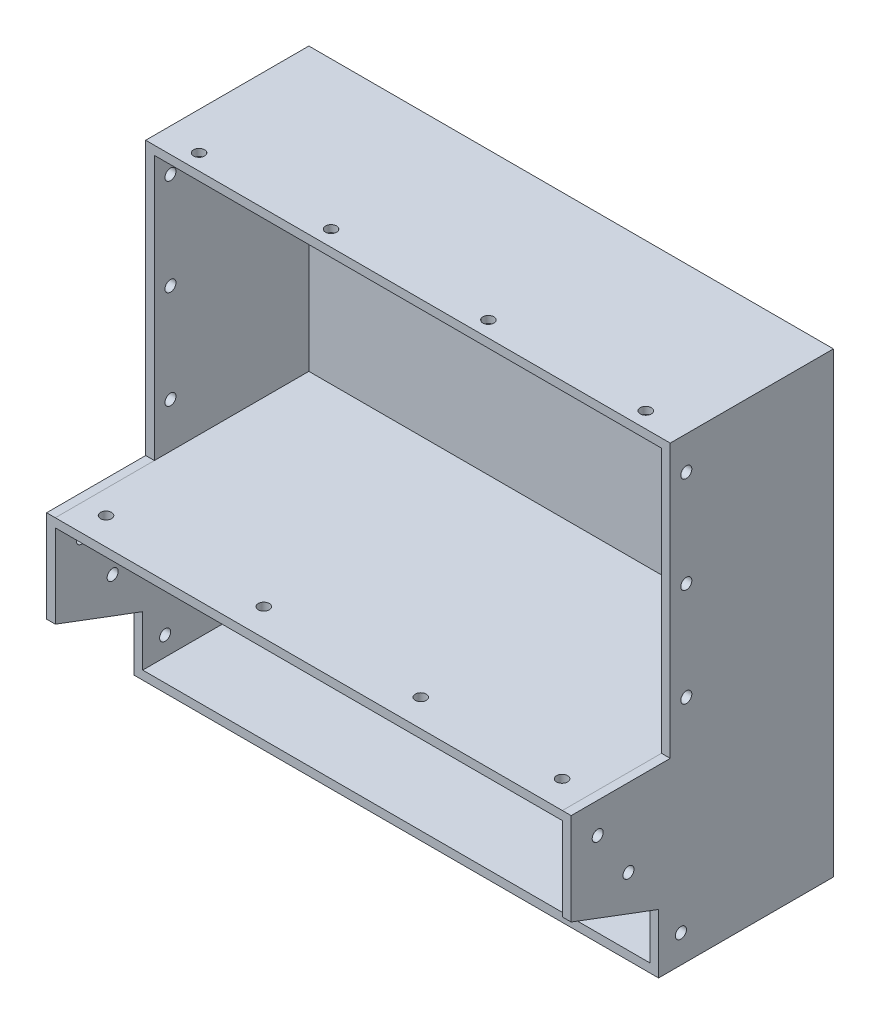
from build123d import *

# Parameters (mm, degrees)
SKETCH1_W           = 190.5
SKETCH1_H           = 166.116
BOSS_EXTRUDE1_DEPTH = 95.25
CUT_EXTRUDE1_DEPTH  = 92.075
CUT_EXTRUDE5_DEPTH  = 35.98418
SKETCH17_W          = 190.5
SKETCH17_H          = 33.474363619
CUT_EXTRUDE6_DEPTH  = 31.75
BOSS_EXTRUDE8_DEPTH = 190.5
SKETCH19_W          = 184.15
SKETCH19_H          = 30.313503047
CUT_EXTRUDE7_DEPTH  = 92.075
SKETCH20_W          = 184.15
SKETCH20_H          = 33.914711244
CUT_EXTRUDE8_DEPTH  = 13.175
CUT_EXTRUDE9_DEPTH  = 60.325
SKETCH23_R          = 2.00000108
CUT_EXTRUDE10_DEPTH = 2.54
SKETCH24_R          = 2
SKETCH24_R_2        = 2.00000108
CUT_EXTRUDE11_DEPTH = 2.54
SKETCH25_R          = 2.00000108
CUT_EXTRUDE12_DEPTH = 229.607619873
SKETCH27_R          = 2.00000108
CUT_EXTRUDE13_DEPTH = 3.175
SKETCH28_R          = 2.00000108
CUT_EXTRUDE15_DEPTH = 229.607619873


with BuildPart() as part:
    # Sketch1 → Boss-Extrude1 (new body)
    with BuildSketch(Plane.XY):
        Rectangle(SKETCH1_W, SKETCH1_H)
    extrude(amount=BOSS_EXTRUDE1_DEPTH)

    # Sketch3 → Cut-Extrude1 (cut)
    with BuildSketch(Plane.XY.offset(95.25)):
        Polygon((83.88326961, 79.883), (-81.085829842, 79.883), (-92.075, 79.883), (-92.075, 32.891702926), (-92.075, -16.095133334), (92.075, -16.095133334), (92.075, 48.662739539), (92.075, 79.883), align=None)
    extrude(amount=-CUT_EXTRUDE1_DEPTH, mode=Mode.SUBTRACT)

    # Sketch15 → Cut-Extrude5 (cut)
    with BuildSketch(Plane.XY.offset(95.25)):
        Polygon((95.25, -16.109272762), (95.25, 83.058), (-95.25, 83.058), (-95.25, -16.109272762), (-92.075, -16.095133334), (-92.075, 79.883), (92.075, 79.883), (92.075, -16.095133334), align=None)
    extrude(amount=-CUT_EXTRUDE5_DEPTH, mode=Mode.SUBTRACT)

    # Sketch17 → Cut-Extrude6 (cut)
    with BuildSketch(Plane.XY.offset(95.25)):
        with Locations((0, -66.320818191)):
            Rectangle(SKETCH17_W, SKETCH17_H)
    extrude(amount=-CUT_EXTRUDE6_DEPTH, mode=Mode.SUBTRACT)

    # Sketch18 → Boss-Extrude8 (add)
    with BuildSketch(Plane.ZY.offset(95.25)):
        Polygon((63.5, -49.583636381), (63.5, -61.506100001), (95.25, -49.583636381), align=None)
    extrude(amount=-BOSS_EXTRUDE8_DEPTH)

    # Sketch19 → Cut-Extrude7 (cut)
    with BuildSketch(Plane.XY.offset(95.25)):
        with Locations((0, -34.426884857)):
            Rectangle(SKETCH19_W, SKETCH19_H)
    extrude(amount=-CUT_EXTRUDE7_DEPTH, mode=Mode.SUBTRACT)

    # Sketch20 → Cut-Extrude8 (cut)
    with BuildSketch(Plane(origin=(0, -74.803163357, 28.08938563), x_dir=(1, 0, 0), z_dir=(0, -0.9361719099317519, 0.3515425366221503))):
        with Locations((0, 54.782261491)):
            Rectangle(SKETCH20_W, SKETCH20_H)
    extrude(amount=-CUT_EXTRUDE8_DEPTH, mode=Mode.SUBTRACT)

    # Sketch21 → Cut-Extrude9 (cut)
    with BuildSketch(Plane.XY.offset(63.5)):
        Polygon((-92.075, -61.506100001), (-92.075, -49.583636381), (92.075, -49.583636381), (92.075, -61.506100001), (92.075, -79.883), (-92.075, -79.883), align=None)
    extrude(amount=-CUT_EXTRUDE9_DEPTH, mode=Mode.SUBTRACT)

    # Sketch23 → Cut-Extrude10 (cut)
    with BuildSketch(Plane.XZ.offset(83.058)):
        with Locations((-83.319719804, 53.848)):
            Circle(SKETCH23_R)
        with Locations((-26.423719804, 53.848)):
            Circle(SKETCH23_R)
        with Locations((30.472280196, 53.848)):
            Circle(SKETCH23_R)
        with Locations((82.288280196, 53.848)):
            Circle(SKETCH23_R)
    extrude(amount=-CUT_EXTRUDE10_DEPTH, mode=Mode.SUBTRACT)

    # Sketch24 → Cut-Extrude11 (cut)
    with BuildSketch(Plane(origin=(0, 83.058, 0), x_dir=(1, 0, 0), z_dir=(0, 1, 0))):
        with Locations((80.65616897, -53.55082)):
            Circle(SKETCH24_R)
        with Locations((23.50616897, -53.55082)):
            Circle(SKETCH24_R_2)
        with Locations((-33.64383103, -53.55082)):
            Circle(SKETCH24_R_2)
        with Locations((-81.568772043, -53.55082)):
            Circle(SKETCH24_R_2)
    extrude(amount=-CUT_EXTRUDE11_DEPTH, mode=Mode.SUBTRACT)

    # Sketch25 → Cut-Extrude12 (cut, through all)
    with BuildSketch(Plane(origin=(95.25, 0, 0), x_dir=(0, 0, -1), z_dir=(1, 0, 0))):
        with Locations((-53.42382, 70.993)):
            Circle(SKETCH25_R)
        with Locations((-53.42382, 35.941)):
            Circle(SKETCH25_R)
        with Locations((-53.42382, 0.217760577)):
            Circle(SKETCH25_R)
    extrude(amount=-CUT_EXTRUDE12_DEPTH, mode=Mode.SUBTRACT)

    # Sketch27 → Cut-Extrude13 (cut)
    with BuildSketch(Plane(origin=(0, -16.095133334, 0), x_dir=(1, 0, 0), z_dir=(0, 1, 0))):
        with Locations((82.042, -85.344)):
            Circle(SKETCH27_R)
        with Locations((30.734, -85.344)):
            Circle(SKETCH27_R)
        with Locations((-26.268567804, -85.344)):
            Circle(SKETCH27_R)
        with Locations((-83.566, -85.344)):
            Circle(SKETCH27_R)
    extrude(amount=-CUT_EXTRUDE13_DEPTH, mode=Mode.SUBTRACT)

    # Sketch28 → Cut-Extrude15 (cut, through all)
    with BuildSketch(Plane(origin=(95.25, 0, 0), x_dir=(0, 0, -1), z_dir=(1, 0, 0))):
        with Locations((-55.372, -72.898)):
            Circle(SKETCH28_R)
        with Locations((-74.422, -44.381878841)):
            Circle(SKETCH28_R)
        with Locations((-85.598, -27.204003713)):
            Circle(SKETCH28_R)
    extrude(amount=-CUT_EXTRUDE15_DEPTH, mode=Mode.SUBTRACT)


solid = part.part
